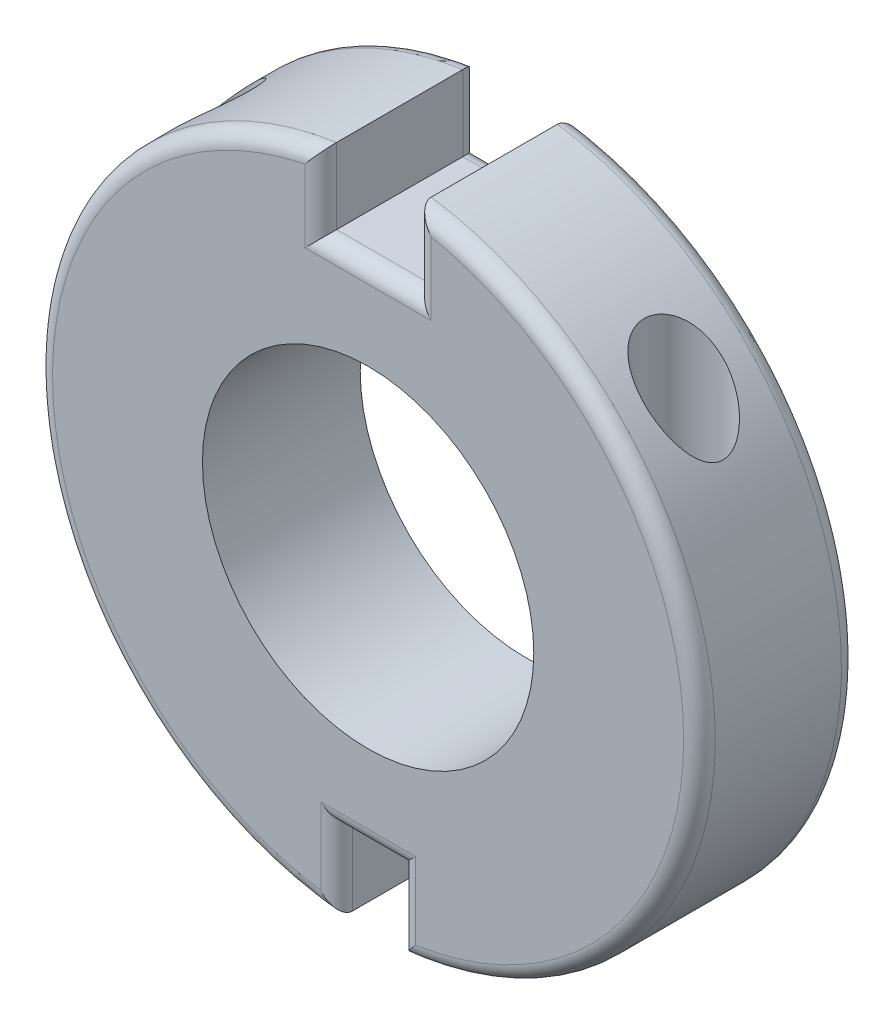
from build123d import *

# Parameters (mm, degrees)
ESQUISSE1_R                  = 10.5
BOSS_EXTRU_1_DEPTH           = 10
ENL_V_MAT_EXTRU_1_DEPTH      = 20
ENL_V_MAT_EXTRU_1_DEPTH_BACK = 10
ESQUISSE2_R                  = 1.25
ENL_V_START                  = 7.5
ESQUISSE2_5_R                = 2.5
ESQUISSE2_5_R_2              = 1.25
ENL_V_MAT_EXTRU_2_DEPTH      = 10
CONG_1_R                     = 1


with BuildPart() as part:
    # Esquisse1 → Boss.-Extru.1 (new body)
    with BuildSketch(Plane.XY):
        with BuildLine():
            Line((-2, -15.90454496), (2, -15.90454496))
            Line((2, -15.90454496), (2, -20.90454496))
            ThreePointArc((2, -20.90454496), (20.993961129, -0.503583277), (3, 20.784609691))
            Line((3, 20.784609691), (3, 16))
            Line((3, 16), (-3, 16))
            Line((-3, 16), (-3, 20.784609691))
            ThreePointArc((-3, 20.784609691), (-20.993961129, -0.503583277), (-2, -20.90454496))
            Line((-2, -20.90454496), (-2, -15.90454496))
        make_face()
        Circle(ESQUISSE1_R, mode=Mode.SUBTRACT)
    extrude(amount=BOSS_EXTRU_1_DEPTH)

    # Esquisse2 → Enlèv. mat.-Extru.1 (cut, two sides: drawn at the far end of the back side and taken through both)
    with BuildSketch(Plane(origin=(0, 0, 0), x_dir=(1, 0, 0), z_dir=(0, 1, 0)).offset(-ENL_V_MAT_EXTRU_1_DEPTH_BACK)):
        with Locations((15, -5)):
            Circle(ESQUISSE2_R)
        with Locations((-15, -5)):
            Circle(ESQUISSE2_R)
    extrude(amount=ENL_V_MAT_EXTRU_1_DEPTH + ENL_V_MAT_EXTRU_1_DEPTH_BACK, mode=Mode.SUBTRACT)

    # Esquisse2<5> → Enlèv. mat.-Extru.2 (cut)
    # profile 1 of 2: a face of its own
    with BuildSketch(Plane(origin=(0, 0, 0), x_dir=(1, 0, 0), z_dir=(0, 1, 0)).offset(ENL_V_START)):
        with Locations((15, -5)):
            Circle(ESQUISSE2_5_R)
        with Locations((15, -5)):
            Circle(ESQUISSE2_5_R_2, mode=Mode.SUBTRACT)
    # profile 2 of 2: a face of its own
    with BuildSketch(Plane(origin=(0, 0, 0), x_dir=(1, 0, 0), z_dir=(0, 1, 0)).offset(ENL_V_START)):
        with Locations((-15, -5)):
            Circle(ESQUISSE2_5_R)
        with Locations((-15, -5)):
            Circle(ESQUISSE2_5_R_2, mode=Mode.SUBTRACT)
    extrude(amount=ENL_V_MAT_EXTRU_2_DEPTH, mode=Mode.SUBTRACT)

    # Congé1
    cong_1_edges = [part.edges().sort_by_distance(p)[0] for p in [
        (-2, -18.40454496, 0),
        (0, -15.90454496, 0),
        (2, -18.40454496, 0),
        (-20.993961129, -0.503583277, 0),
        (-3, 18.392304845, 0),
        (0, 16, 0),
        (3, 18.392304845, 0),
        (20.993961129, -0.503583277, 0),
        (-2, -18.40454496, 10),
        (0, -15.90454496, 10),
        (2, -18.40454496, 10),
        (-3, 18.392304845, 10),
        (0, 16, 10),
        (3, 18.392304845, 10),
        (20.993961129, -0.503583277, 10),
        (-20.993961129, -0.503583277, 10),
    ]]
    fillet(cong_1_edges, radius=CONG_1_R)


solid = part.part
